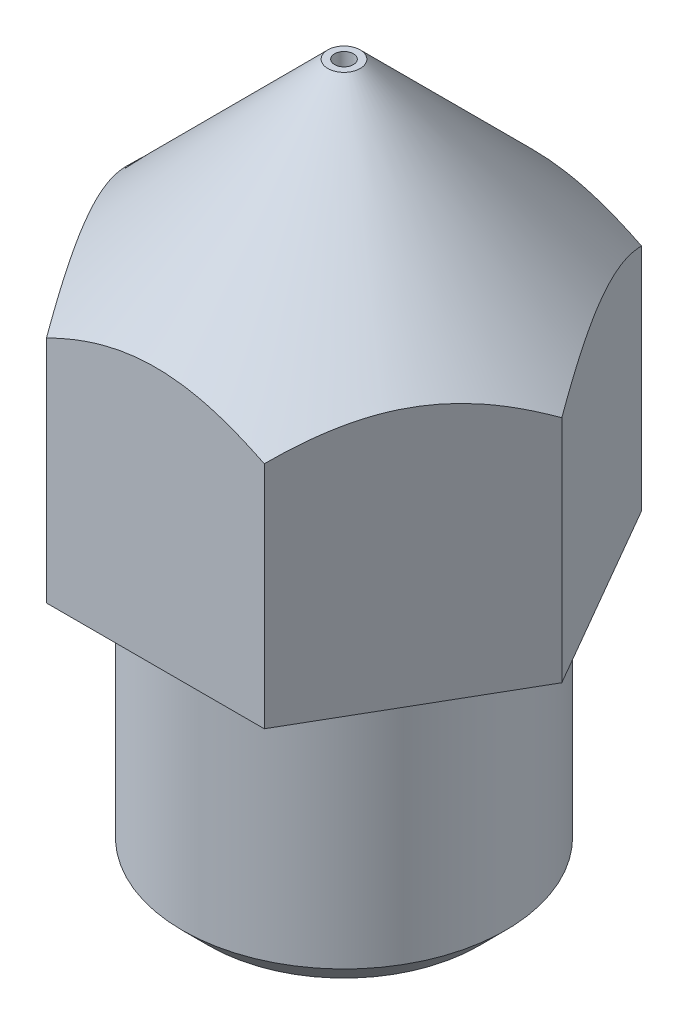
from build123d import *

# Parameters (mm, degrees)
SKETCH1_R           = 3
BOSS_EXTRUDE1_DEPTH = 5
BOSS_EXTRUDE2_DEPTH = 8


with BuildPart() as part:
    # Sketch1 → Boss-Extrude1 (new body)
    with BuildSketch(Plane(origin=(0, 0, 0), x_dir=(1, 0, 0), z_dir=(0, 1, 0))):
        Circle(SKETCH1_R)
    extrude(amount=BOSS_EXTRUDE1_DEPTH)

    # Sketch2 → Boss-Extrude2 (add)
    with BuildSketch(Plane(origin=(0, 5, 0), x_dir=(1, 0, 0), z_dir=(0, 1, 0))):
        Polygon((2.020725942, 3.5), (-2.020725942, 3.5), (-4.041451884, 0), (-2.020725942, -3.5), (2.020725942, -3.5), (4.041451884, 0), align=None)
    extrude(amount=BOSS_EXTRUDE2_DEPTH)

    # Sketch4 → Cut-Revolve2 (revolve, cut)
    with BuildSketch(Plane.XY):
        Polygon((0.3, 13), (4.041451884, 9.258548116), (4.041451884, 13), align=None)
    revolve(axis=Axis((0, 0, 0), (0, 1, 0)), mode=Mode.SUBTRACT)

    # Sketch5 → Cut-Revolve3 (revolve, cut)
    with BuildSketch(Plane.XY):
        Polygon((2.5, 0), (3, 0.5), (3, 0), align=None)
    revolve(axis=Axis((0, 13, 0), (0, -1, 0)), mode=Mode.SUBTRACT)

    # Sketch6 → Cut-Revolve4 (revolve, cut)
    with BuildSketch(Plane.XY):
        Polygon((0.175, 13), (0, 13), (0, 0), (1.25, 0), (1.25, 10.638045382), (0.175, 12.5), align=None)
    revolve(axis=Axis((0, 13, 0), (0, -1, 0)), mode=Mode.SUBTRACT)


solid = part.part
